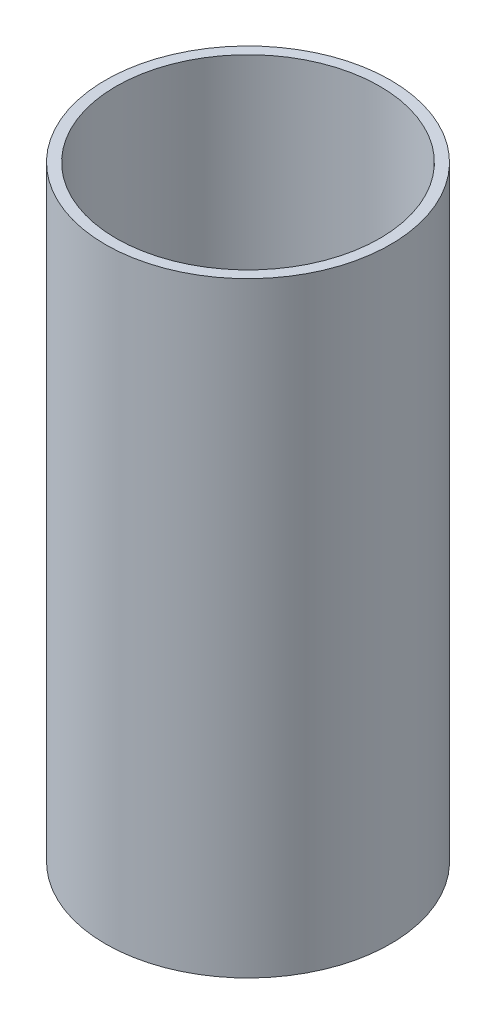
from build123d import *

# Parameters (mm, degrees)
SKETCH_1_R      = 20
SKETCH_1_R_2    = 4.7
EXTRUDE_1_DEPTH = 2.5
SKETCH_2_R      = 20
EXTRUDE_2_DEPTH = 2.5
FILLET_1_R      = 5
SKETCH_3_R      = 20
SKETCH_3_R_2    = 18.500135374
EXTRUDE_3_DEPTH = 80


with BuildPart() as part:
    # 草图1 → 凸台-拉伸1 (new body)
    with BuildSketch(Plane(origin=(0, 0, 0), x_dir=(1, 0, 0), z_dir=(0, 1, 0))):
        Circle(SKETCH_1_R)
        Circle(SKETCH_1_R_2, mode=Mode.SUBTRACT)
    extrude(amount=EXTRUDE_1_DEPTH)

    # 草图2 → 凸台-拉伸2 (add)
    with BuildSketch(Plane(origin=(0, 2.5, 0), x_dir=(1, 0, 0), z_dir=(0, 1, 0))):
        Circle(SKETCH_2_R)
        with BuildLine():
            Line((-1.563432113, -17.075590083), (-4.71068404, -4.96235635))
            Line((-4.71068404, -4.96235635), (-17.004080234, -2.254434443))
            ThreePointArc((-17.004080234, -2.254434443), (-18.064494297, -1.603755329), (-18.494985714, -0.436477113))
            Line((-18.494985714, -0.436477113), (-18.496384796, -0.365717778))
            Line((-18.496384796, -0.365717778), (-18.497425733, -0.313071754))
            ThreePointArc((-18.497425733, -0.313071754), (-18.11217817, 0.871942042), (-17.075590083, 1.563432113))
            Line((-17.075590083, 1.563432113), (-4.96235635, 4.71068404))
            Line((-4.96235635, 4.71068404), (-2.254434443, 17.004080234))
            ThreePointArc((-2.254434443, 17.004080234), (-1.616612902, 18.053855023), (-0.469840502, 18.494032819))
            ThreePointArc((-0.469840502, 18.494032819), (-0.417780795, 18.49528208), (-0.365717778, 18.496384796))
            Line((-0.365717778, 18.496384796), (-0.313071754, 18.497425733))
            ThreePointArc((-0.313071754, 18.497425733), (0.871942042, 18.11217817), (1.563432113, 17.075590083))
            Line((1.563432113, 17.075590083), (4.71068404, 4.96235635))
            Line((4.71068404, 4.96235635), (17.004080234, 2.254434443))
            ThreePointArc((17.004080234, 2.254434443), (18.053855023, 1.616612902), (18.494032819, 0.469840502))
            ThreePointArc((18.494032819, 0.469840502), (18.49528208, 0.417780795), (18.496384796, 0.365717778))
            Line((18.496384796, 0.365717778), (18.497425733, 0.313071754))
            ThreePointArc((18.497425733, 0.313071754), (18.11217817, -0.871942042), (17.075590083, -1.563432113))
            Line((17.075590083, -1.563432113), (4.96235635, -4.71068404))
            Line((4.96235635, -4.71068404), (2.254434443, -17.004080234))
            ThreePointArc((2.254434443, -17.004080234), (1.616612902, -18.053855023), (0.469840502, -18.494032819))
            ThreePointArc((0.469840502, -18.494032819), (0.417780795, -18.49528208), (0.365717778, -18.496384796))
            Line((0.365717778, -18.496384796), (0.313071754, -18.497425733))
            ThreePointArc((0.313071754, -18.497425733), (-0.871942042, -18.11217817), (-1.563432113, -17.075590083))
        make_face(mode=Mode.SUBTRACT)
    extrude(amount=EXTRUDE_2_DEPTH)

    # 圆角1
    fillet_1_edges = [part.edges().sort_by_distance(p)[0] for p in [
        (-4.71068404, 3.75, 4.96235635),
        (-4.96235635, 3.75, -4.71068404),
        (4.96235635, 3.75, 4.71068404),
        (4.71068404, 3.75, -4.96235635),
    ]]
    fillet(fillet_1_edges, radius=FILLET_1_R)

    # 草图3 → 凸台-拉伸3 (add)
    with BuildSketch(Plane(origin=(0, 5, 0), x_dir=(1, 0, 0), z_dir=(0, 1, 0))):
        Circle(SKETCH_3_R)
        Circle(SKETCH_3_R_2, mode=Mode.SUBTRACT)
    extrude(amount=EXTRUDE_3_DEPTH)


solid = part.part
